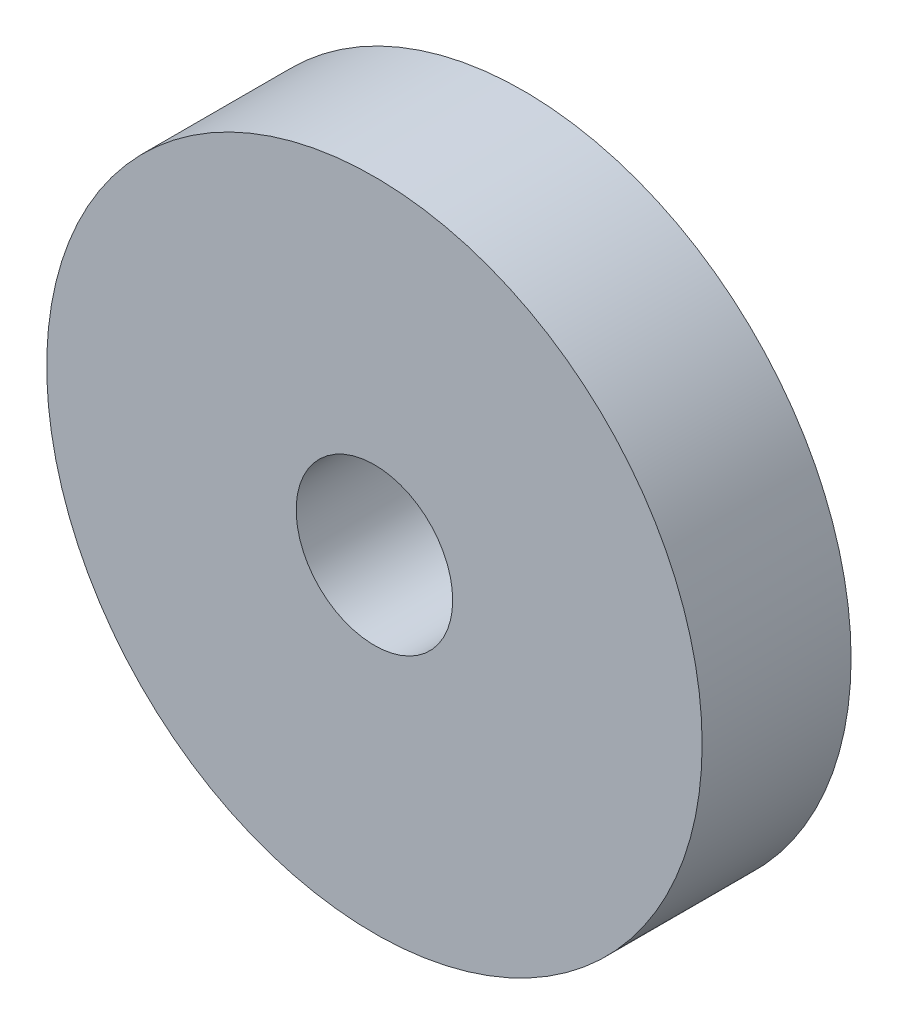
from build123d import *

# Parameters (mm, degrees)
SKETCH2_R           = 11
BOSS_EXTRUDE1_DEPTH = 5
SKETCH3_R           = 2.627
CUT_EXTRUDE1_DEPTH  = 5


with BuildPart() as part:
    # Sketch2 → Boss-Extrude1 (new body)
    with BuildSketch(Plane.XY):
        Circle(SKETCH2_R)
    extrude(amount=BOSS_EXTRUDE1_DEPTH)

    # Sketch3 → Cut-Extrude1 (cut)
    with BuildSketch(Plane.XY.offset(5)):
        Circle(SKETCH3_R)
    extrude(amount=-CUT_EXTRUDE1_DEPTH, mode=Mode.SUBTRACT)


solid = part.part
